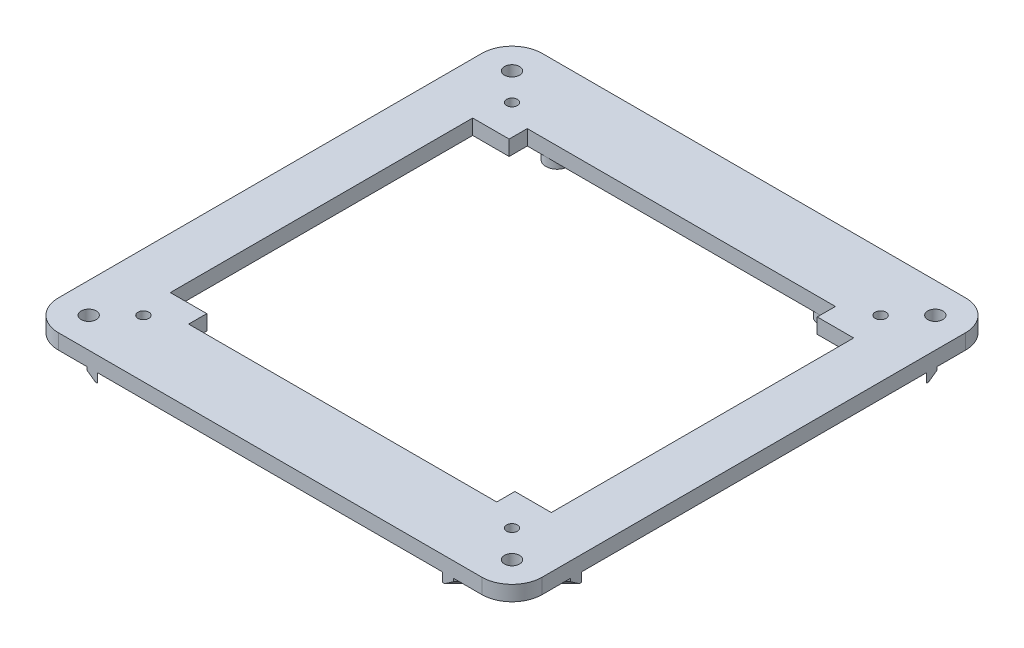
from build123d import *
from build123d.topology import SkipClean

# Parameters (mm, degrees)
SKETCH1_W           = 160.02
SKETCH1_H           = 127
BOSS_EXTRUDE2_DEPTH = 6.35
SKETCH2_R           = 3.175
CUT_EXTRUDE1_DEPTH  = 262.894200967
SKETCH8_R           = 2.286
CUT_EXTRUDE4_DEPTH  = 262.894200967
SKETCH9_W           = 129.404437756
SKETCH9_H           = 7.62
CUT_EXTRUDE5_DEPTH  = 262.894200967
SKETCH10_R          = 4.826
SKETCH10_R_2        = 2.286
BOSS_EXTRUDE3_DEPTH = 3.81
BOSS_EXTRUDE4_DEPTH = 3.81
CHAMFER1_SIZE       = 2.54


with BuildPart() as part:
    # Sketch1 → Boss-Extrude2 (new body)
    with BuildSketch(Plane(origin=(0, 0, 0), x_dir=(1, 0, 0), z_dir=(0, 1, 0))):
        with BuildLine():
            Line((0, 0), (0, 25.4))
            ThreePointArc((0, 25.4), (3.719743879, 34.380256121), (12.7, 38.1))
            Line((12.7, 38.1), (190.5, 38.1))
            ThreePointArc((190.5, 38.1), (199.480256121, 34.380256121), (203.2, 25.4))
            Line((203.2, 25.4), (203.2, -152.4))
            ThreePointArc((203.2, -152.4), (199.480256121, -161.380256121), (190.5, -165.1))
            Line((190.5, -165.1), (12.7, -165.1))
            ThreePointArc((12.7, -165.1), (3.719743879, -161.380256121), (0, -152.4))
            Line((0, -152.4), (0, -127))
            Line((0, -127), (0, 0))
        make_face()
        with Locations((101.6, -63.5)):
            Rectangle(SKETCH1_W, SKETCH1_H, mode=Mode.SUBTRACT)
    extrude(amount=BOSS_EXTRUDE2_DEPTH)

    # Sketch2 → Cut-Extrude1 (cut, through all)
    with BuildSketch(Plane(origin=(0, 6.35, 0), x_dir=(1, 0, 0), z_dir=(0, 1, 0))):
        with Locations((12.7, 25.4)):
            Circle(SKETCH2_R)
        with Locations((190.5, 25.4)):
            Circle(SKETCH2_R)
        with Locations((190.5, -152.4)):
            Circle(SKETCH2_R)
        with Locations((12.7, -152.4)):
            Circle(SKETCH2_R)
    extrude(amount=-CUT_EXTRUDE1_DEPTH, mode=Mode.SUBTRACT)

    # Sketch8 → Cut-Extrude4 (cut, through all)
    with BuildSketch(Plane(origin=(0, 0, 0), x_dir=(-1, 0, 0), z_dir=(0, -1, 0))):
        with Locations((-24.197781122, 13.902218878)):
            Circle(SKETCH8_R)
        with Locations((-24.197781122, -140.902218878)):
            Circle(SKETCH8_R)
        with Locations((-179.002218878, -140.902218878)):
            Circle(SKETCH8_R)
        with Locations((-179.002218878, 13.902218878)):
            Circle(SKETCH8_R)
    extrude(amount=-CUT_EXTRUDE4_DEPTH, mode=Mode.SUBTRACT)

    # Sketch9 → Cut-Extrude5 (cut, through all)
    with BuildSketch(Plane(origin=(0, 6.35, 0), x_dir=(1, 0, 0), z_dir=(0, 1, 0))):
        with Locations((101.6, 3.81)):
            Rectangle(SKETCH9_W, SKETCH9_H)
        with Locations((101.6, -130.81)):
            Rectangle(SKETCH9_W, SKETCH9_H)
    extrude(amount=-CUT_EXTRUDE5_DEPTH, mode=Mode.SUBTRACT)

    # Sketch10 → Boss-Extrude3 (add)
    # profile 1 of 4: a face of its own
    with BuildSketch(Plane(origin=(0, 0, 0), x_dir=(-1, 0, 0), z_dir=(0, -1, 0))):
        with Locations((-44.45, 12.7)):
            Circle(SKETCH10_R)
        with Locations((-44.45, 12.7)):
            Circle(SKETCH10_R_2, mode=Mode.SUBTRACT)
    # profile 2 of 4: a face of its own
    with BuildSketch(Plane(origin=(0, 0, 0), x_dir=(-1, 0, 0), z_dir=(0, -1, 0))):
        with Locations((-158.75, 12.7)):
            Circle(SKETCH10_R)
        with Locations((-158.75, 12.7)):
            Circle(SKETCH10_R_2, mode=Mode.SUBTRACT)
    # profile 3 of 4: a face of its own
    with BuildSketch(Plane(origin=(0, 0, 0), x_dir=(-1, 0, 0), z_dir=(0, -1, 0))):
        with Locations((-158.75, -139.7)):
            Circle(SKETCH10_R)
        with Locations((-158.75, -139.7)):
            Circle(SKETCH10_R_2, mode=Mode.SUBTRACT)
    # profile 4 of 4: a face of its own
    with BuildSketch(Plane(origin=(0, 0, 0), x_dir=(-1, 0, 0), z_dir=(0, -1, 0))):
        with Locations((-44.45, -139.7)):
            Circle(SKETCH10_R)
        with Locations((-44.45, -139.7)):
            Circle(SKETCH10_R_2, mode=Mode.SUBTRACT)
    extrude(amount=BOSS_EXTRUDE3_DEPTH)

    # Sketch11 → Boss-Extrude4 (add)
    with SkipClean():  # the faces are left unmerged after this step: merging them gives an invalid solid
        with BuildSketch(Plane.XZ):
            with BuildLine():
                Line((174.07128, -38.1), (187.384850533, -24.786429467))
                ThreePointArc((187.384850533, -24.786429467), (187.552268433, -26.579620112), (188.668154157, -27.993253903))
                Line((188.668154157, -27.993253903), (178.561408061, -38.1))
                Line((178.561408061, -38.1), (174.07128, -38.1))
            make_face()
            with BuildLine():
                Line((203.2, -8.97128), (203.2, -13.461408061))
                Line((203.2, -13.461408061), (193.093253903, -23.568154157))
                ThreePointArc((193.093253903, -23.568154157), (191.679620112, -22.452268433), (189.886429467, -22.284850533))
                Line((189.886429467, -22.284850533), (203.2, -8.97128))
            make_face()
            with BuildLine():
                Line((10.106746097, -23.568154157), (0, -13.461408061))
                Line((0, -13.461408061), (0, -8.97128))
                Line((0, -8.97128), (13.313570533, -22.284850533))
                ThreePointArc((13.313570533, -22.284850533), (11.520379888, -22.452268433), (10.106746097, -23.568154157))
            make_face()
            with BuildLine():
                Line((15.815149467, -24.786429467), (29.12872, -38.1))
                Line((29.12872, -38.1), (24.638591939, -38.1))
                Line((24.638591939, -38.1), (14.531845843, -27.993253903))
                ThreePointArc((14.531845843, -27.993253903), (15.647731567, -26.579620112), (15.815149467, -24.786429467))
            make_face()
            with BuildLine():
                Line((14.531845843, 154.993253903), (24.638591939, 165.1))
                Line((24.638591939, 165.1), (29.12872, 165.1))
                Line((29.12872, 165.1), (15.815149467, 151.786429467))
                ThreePointArc((15.815149467, 151.786429467), (15.647731567, 153.579620112), (14.531845843, 154.993253903))
            make_face()
            with BuildLine():
                Line((13.313570533, 149.284850533), (0, 135.97128))
                Line((0, 135.97128), (0, 140.461408061))
                Line((0, 140.461408061), (10.106746097, 150.568154157))
                ThreePointArc((10.106746097, 150.568154157), (11.520379888, 149.452268433), (13.313570533, 149.284850533))
            make_face()
            with BuildLine():
                Line((193.093253903, 150.568154157), (203.2, 140.461408061))
                Line((203.2, 140.461408061), (203.2, 135.97128))
                Line((203.2, 135.97128), (189.886429467, 149.284850533))
                ThreePointArc((189.886429467, 149.284850533), (191.679620112, 149.452268433), (193.093253903, 150.568154157))
            make_face()
            with BuildLine():
                Line((187.384850533, 151.786429467), (174.07128, 165.1))
                Line((174.07128, 165.1), (178.561408061, 165.1))
                Line((178.561408061, 165.1), (188.668154157, 154.993253903))
                ThreePointArc((188.668154157, 154.993253903), (187.552268433, 153.579620112), (187.384850533, 151.786429467))
            make_face()
        extrude(amount=BOSS_EXTRUDE4_DEPTH)

    # Chamfer1
    chamfer1_edges = [part.edges().sort_by_distance(p)[0] for p in [
        (19.585218891, -3.81, 160.046626952),
        (5.053373048, -3.81, 145.514781109),
        (183.614781109, -3.81, 160.046626952),
        (198.146626952, -3.81, 145.514781109),
        (183.614781109, -3.81, -33.046626952),
        (198.146626952, -3.81, -18.514781109),
        (5.053373048, -3.81, -18.514781109),
        (19.585218891, -3.81, -33.046626952),
    ]]
    chamfer(chamfer1_edges, length=CHAMFER1_SIZE)


solid = part.part
